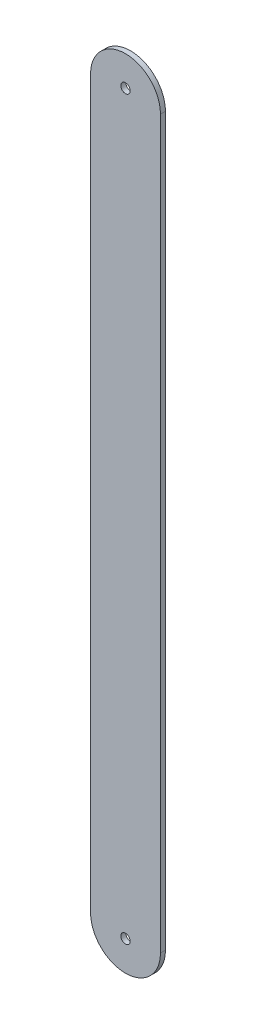
from build123d import *

# Parameters (mm, degrees)
SKETCH1_R           = 1.5
BOSS_EXTRUDE1_DEPTH = 1.5875


with BuildPart() as part:
    # Sketch1 → Boss-Extrude1 (new body)
    with BuildSketch(Plane.XY):
        with BuildLine():
            Line((11.1125, -115.51857), (11.1125, 115.51857))
            ThreePointArc((11.1125, 115.51857), (0, 126.63107), (-11.1125, 115.51857))
            Line((-11.1125, 115.51857), (-11.1125, -115.51857))
            ThreePointArc((-11.1125, -115.51857), (0, -126.63107), (11.1125, -115.51857))
        make_face()
        with Locations((0, 117.10607)):
            Circle(SKETCH1_R, mode=Mode.SUBTRACT)
        with Locations((0, -117.10607)):
            Circle(SKETCH1_R, mode=Mode.SUBTRACT)
    extrude(amount=BOSS_EXTRUDE1_DEPTH)


solid = part.part
